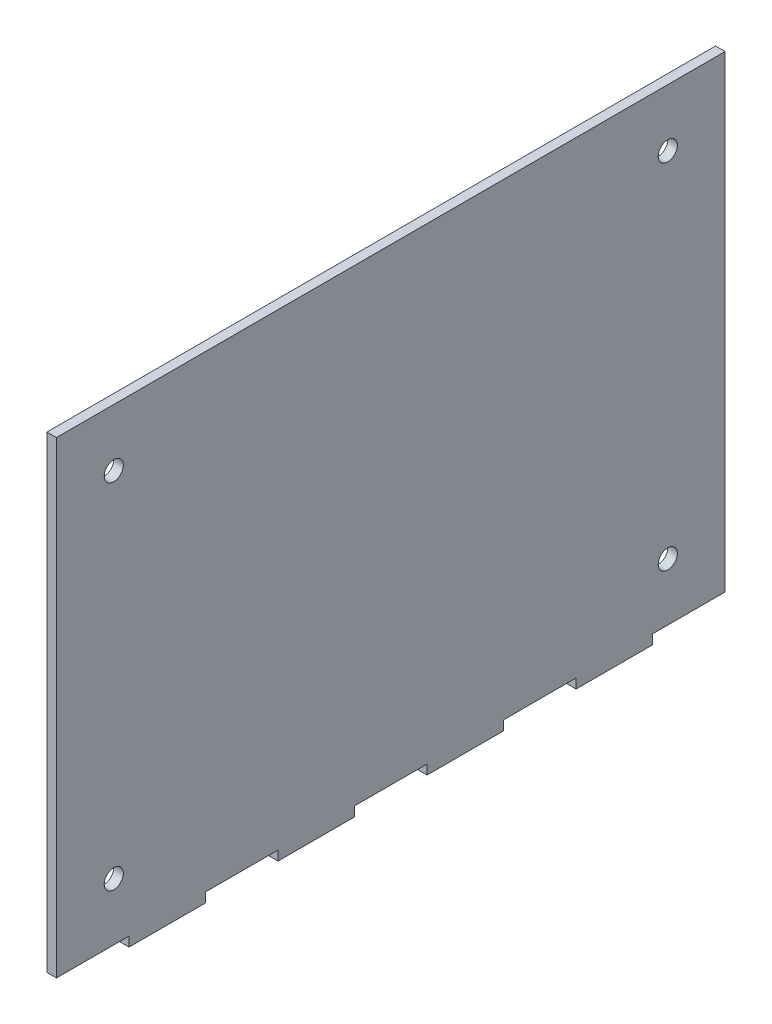
from build123d import *

# Parameters (mm, degrees)
SKIZZE1_W                  = 350
SKIZZE1_H                  = 250
GRUNDPLATTE_DEPTH          = 5
SKIZZE2_W                  = 38
SKIZZE2_H                  = 5
ZAPFEN_BODEN_DEPTH         = 306.204849241
SKIZZE3_R                  = 5
VERBINDUNGSBOHRUNGEN_DEPTH = 306.204849241


with BuildPart() as part:
    # Skizze1 → Grundplatte (new body)
    with BuildSketch(Plane(origin=(0, 0, 0), x_dir=(0, 0, -1), z_dir=(1, 0, 0))):
        with Locations((0, 125)):
            Rectangle(SKIZZE1_W, SKIZZE1_H)
    extrude(amount=GRUNDPLATTE_DEPTH)

    # Skizze2 → Zapfen Boden (cut, through all)
    with BuildSketch(Plane(origin=(5, 0, 0), x_dir=(0, 0, -1), z_dir=(1, 0, 0))):
        with Locations((-156, 2.5)):
            Rectangle(SKIZZE2_W, SKIZZE2_H)
        with Locations((-78, 2.5)):
            Rectangle(SKIZZE2_W, SKIZZE2_H)
        with Locations((0, 2.5)):
            Rectangle(SKIZZE2_W, SKIZZE2_H)
        with Locations((78, 2.5)):
            Rectangle(SKIZZE2_W, SKIZZE2_H)
        with Locations((156, 2.5)):
            Rectangle(SKIZZE2_W, SKIZZE2_H)
    extrude(amount=-ZAPFEN_BODEN_DEPTH, mode=Mode.SUBTRACT)

    # Skizze3 → Verbindungsbohrungen (cut, through all)
    with BuildSketch(Plane(origin=(5, 0, 0), x_dir=(0, 0, -1), z_dir=(1, 0, 0))):
        with Locations((145, 220)):
            Circle(SKIZZE3_R)
        with Locations((-145, 220)):
            Circle(SKIZZE3_R)
        with Locations((-145, 35)):
            Circle(SKIZZE3_R)
        with Locations((145, 35)):
            Circle(SKIZZE3_R)
    extrude(amount=-VERBINDUNGSBOHRUNGEN_DEPTH, mode=Mode.SUBTRACT)


solid = part.part
